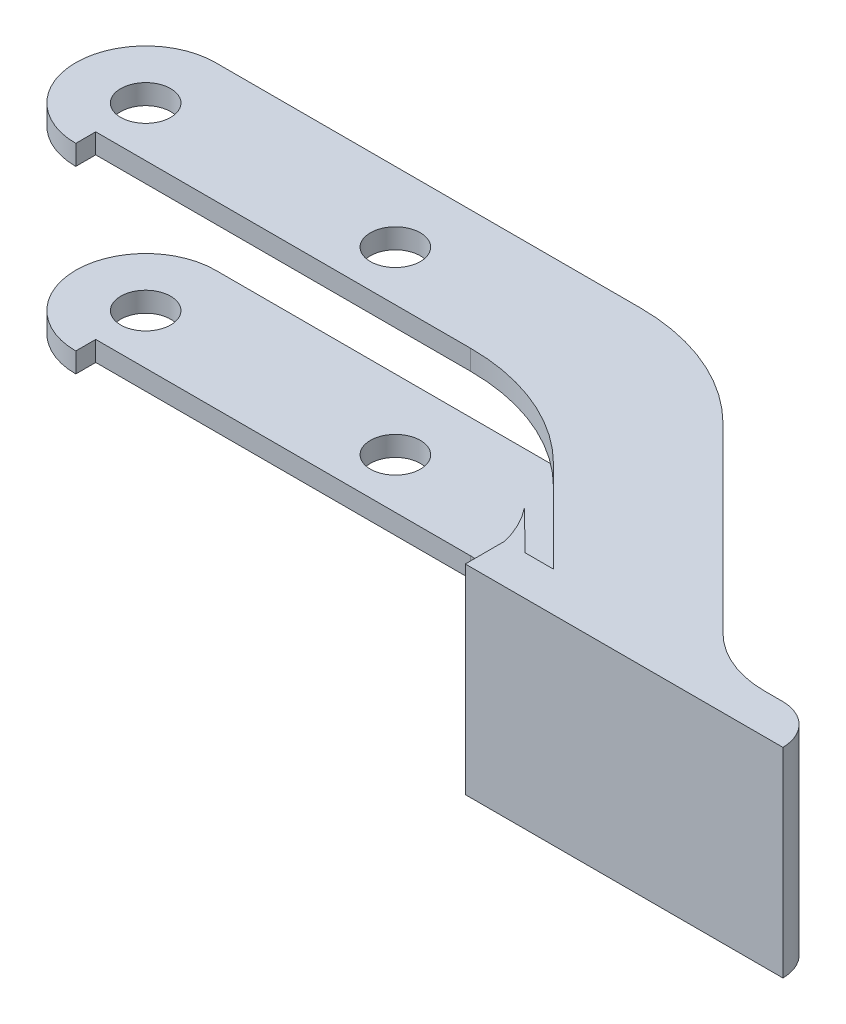
from build123d import *

# Parameters (mm, degrees)
SKETCH1_R                = 2.5
BOSS_EXTRUDE1_DEPTH      = 2
BOSS_EXTRUDE2_DEPTH      = 2
BOSS_EXTRUDE3_DEPTH      = 18
BOSS_EXTRUDE3_DEPTH_BACK = 2
SKETCH4_W                = 31.798989874
SKETCH4_H                = 3.966560298
BOSS_EXTRUDE5_START      = -2
SKETCH6_R                = 2.5
BOSS_EXTRUDE5_DEPTH      = 2
FILLET1_R                = 10
FILLET2_R                = 10
FILLET4_R                = 4
CUT_EXTRUDE1_DEPTH       = 94.156093248


with BuildPart() as part:
    # Sketch1 → Boss-Extrude1 (new body)
    with BuildSketch(Plane(origin=(0, 0, 0), x_dir=(1, 0, 0), z_dir=(0, 1, 0))):
        with BuildLine():
            Line((0, 7), (25, 7))
            ThreePointArc((25, 7), (32, 0), (25, -7))
            Line((25, -7), (0, -7))
            ThreePointArc((0, -7), (-7, 0), (0, 7))
        make_face()
        with Locations(Location((0, 0, 0), (0, 0, 270))):
            Circle(SKETCH1_R, mode=Mode.SUBTRACT)
        with Locations(Location((25, 0, 0), (0, 0, 270))):
            Circle(SKETCH1_R, mode=Mode.SUBTRACT)
    extrude(amount=BOSS_EXTRUDE1_DEPTH)

    # Sketch3 → Boss-Extrude2 (add)
    with BuildSketch(Plane(origin=(0, 0, 0), x_dir=(-1, 0, 0), z_dir=(0, -1, 0))):
        with BuildLine():
            Line((-25, -7), (-36.715728753, -7))
            ThreePointArc((-36.715728753, -7), (-44.3693974, -8.52240935), (-50.857864376, -12.857864376))
            Line((-50.857864376, -12.857864376), (-61.970562748, -23.970562748))
            Line((-61.970562748, -23.970562748), (-81.769552622, -23.970562748))
            Line((-81.769552622, -23.970562748), (-71.870057685, -14.071067812))
            Line((-71.870057685, -14.071067812), (-56.656854249, 1.142135624))
            ThreePointArc((-56.656854249, 1.142135624), (-50.168387273, 5.47759065), (-42.514718626, 7))
            Line((-42.514718626, 7), (-25, 7))
            ThreePointArc((-25, 7), (-32, 0), (-25, -7))
        make_face()
    boss_extrude2 = extrude(amount=-BOSS_EXTRUDE2_DEPTH)

    # Sketch4 → Boss-Extrude3 (add, two sides: drawn at the far end of the back side and taken through both)
    with BuildSketch(Plane(origin=(0, 2, 0), x_dir=(1, 0, 0), z_dir=(0, 1, 0)).offset(-BOSS_EXTRUDE3_DEPTH_BACK)):
        with Locations((71.870057685, -21.987282599)):
            Rectangle(SKETCH4_W, SKETCH4_H)
    extrude(amount=BOSS_EXTRUDE3_DEPTH + BOSS_EXTRUDE3_DEPTH_BACK)

    # Mirror1: Boss-Extrude2 across plane
    add(boss_extrude2.mirror(Plane.ZX.offset(10)))

    # Sketch6 → Boss-Extrude5 (add)
    with BuildSketch(Plane(origin=(0, 20, 0), x_dir=(1, 0, 0), z_dir=(0, 1, 0)).offset(BOSS_EXTRUDE5_START)):
        with BuildLine():
            Line((25, -7), (0, -7))
            ThreePointArc((0, -7), (-7, 0), (0, 7))
            Line((0, 7), (25, 7))
            ThreePointArc((25, 7), (32, 0), (25, -7))
        make_face()
        with Locations(Location((0, 0, 0), (0, 0, 270))):
            Circle(SKETCH6_R, mode=Mode.SUBTRACT)
        with Locations(Location((25, 0, 0), (0, 0, 270))):
            Circle(SKETCH6_R, mode=Mode.SUBTRACT)
    extrude(amount=BOSS_EXTRUDE5_DEPTH)

    # Fillet1
    # the kernel refuses this fillet: 10 mm, written as the material it adds along each edge
    with BuildSketch(Plane(origin=(58.00400245, 0, 20.00400245), x_dir=(-1, 0, 0), z_dir=(0, 1, 0)), Plane(origin=(58.00400245, 18, 20.00400245), x_dir=(-1, 0, 0), z_dir=(0, 1, 0))) as fillet1_piece_1:
        with BuildLine():
            CenterArc((11.740850866, 2.401284758), FILLET1_R, 193.894123227, 31.105876773)
            Line((4.669783054, -4.669783054), (0, 0))
            Line((0, 0), (2.033439702, 0))
        make_face()
    extrude(amount=2)
    with BuildSketch(Plane(origin=(58.00400245, -16.510176322, 20.00400245), x_dir=(-1, 0, 0), z_dir=(0, 1, 0))) as fillet1_piece_2_section:
        with BuildLine():
            CenterArc((11.740850866, 2.401284758), FILLET1_R, 193.894123227, 31.105876773)
            Line((4.669783054, -4.669783054), (0, 0))
            Line((0, 0), (2.033439702, 0))
        make_face()
    fillet1_piece_2 = extrude(amount=35.020352644, mode=Mode.PRIVATE)
    fillet1_piece_2 = split(fillet1_piece_2, bisect_by=Plane(origin=(54.988670777, 18, 17.479262968), z_dir=(0, 1, 0)), keep=Keep.TOP, mode=Mode.PRIVATE)
    add(fillet1_piece_2)
    with BuildSketch(Plane(origin=(58.00400245, 1.489823678, 20.00400245), x_dir=(-1, 0, 0), z_dir=(0, 1, 0))) as fillet1_piece_3_section:
        with BuildLine():
            CenterArc((11.740850866, 2.401284758), FILLET1_R, 193.894123227, 31.105876773)
            Line((4.669783054, -4.669783054), (0, 0))
            Line((0, 0), (2.033439702, 0))
        make_face()
    fillet1_piece_3 = extrude(amount=35.020352644, mode=Mode.PRIVATE)
    fillet1_piece_3 = split(fillet1_piece_3, bisect_by=Plane(origin=(54.988670777, 2, 17.479262968), z_dir=(0, -1, 0)), keep=Keep.TOP, mode=Mode.PRIVATE)
    add(fillet1_piece_3)

    # Fillet2
    fillet2_edges = [part.edges().sort_by_distance(p)[0] for p in [
        (77.802992324, 1, 20.00400245),
        (77.802992324, 19, 20.00400245),
    ]]
    fillet(fillet2_edges, radius=FILLET2_R)

    # Fillet4
    # the kernel refuses this fillet: 4 mm, written as the material it takes off along each edge
    with BuildSketch(Plane(origin=(87.769552622, 30, 20.00400245), x_dir=(0, 0, 1), z_dir=(0, -1, 0))) as fillet4_piece_1:
        with BuildLine():
            CenterArc((FILLET4_R, FILLET4_R), FILLET4_R, 180, 90)
            Line((0, FILLET4_R), (0, 0))
            Line((0, 0), (FILLET4_R, 0))
        make_face()
    extrude(amount=40, mode=Mode.SUBTRACT)

    # Sketch8 → Cut-Extrude1 (cut, through all)
    with BuildSketch(Plane.XZ):
        with BuildLine():
            Line((0, 5), (25, 5))
            Line((25, 5), (37.544155877, 5))
            ThreePointArc((37.544155877, 5), (45.197824525, 6.52240935), (51.686291501, 10.857864376))
            Line((51.686291501, 10.857864376), (60.832429575, 20.00400245))
            Line((60.832429575, 20.00400245), (58.00400245, 20.00400245))
            Line((58.00400245, 20.00400245), (50.528510621, 12.697308088))
            ThreePointArc((50.528510621, 12.697308088), (44.096826604, 8.479014089), (36.548775141, 7))
            Line((36.548775141, 7), (0, 7))
            Line((0, 7), (0, 5))
        make_face()
    extrude(amount=-CUT_EXTRUDE1_DEPTH, mode=Mode.SUBTRACT)


solid = part.part
